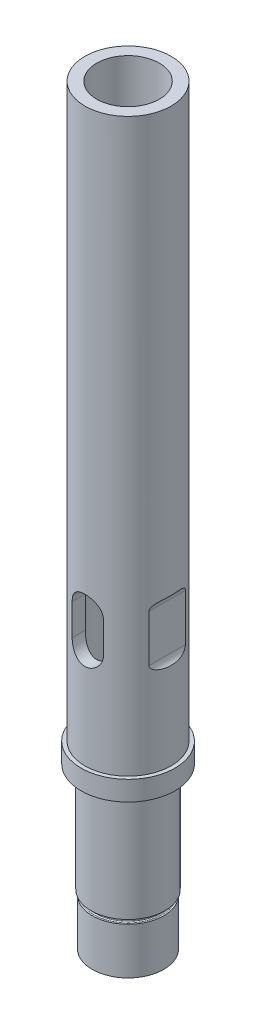
from build123d import *
from build123d.topology import SkipClean

# Parameters (mm, degrees)
SKETCH1_R               = 22.5
SKETCH1_R_2             = 9.525
BOSS_EXTRUDE1_DEPTH     = 95
SKETCH2_OUTSIDE_W       = 69.87
SKETCH2_OUTSIDE_H       = 69.87
SKETCH2_OUTSIDE_R       = 15
CUT_EXTRUDE1_DEPTH      = 50
SKETCH4_OUTSIDE_W       = 69.87
SKETCH4_OUTSIDE_H       = 69.87
SKETCH4_OUTSIDE_R       = 17.5
CUT_EXTRUDE2_DEPTH      = 37
SKETCH11_OUTSIDE_W      = 69.87
SKETCH11_OUTSIDE_H      = 69.87
SKETCH11_OUTSIDE_R      = 14.513
CUT_EXTRUDE3_DEPTH      = 5.88
SKETCH12_R              = 17.5
SKETCH12_R_2            = 9.525
BOSS_EXTRUDE2_DEPTH     = 203.2
BOSS_EXTRUDE3_START     = 15
SKETCH13_R              = 14.513
SKETCH13_R_2            = 9.525
BOSS_EXTRUDE3_DEPTH     = 15
SKETCH15_OUTSIDE_W      = 110.92
SKETCH15_OUTSIDE_H      = 110.92
SKETCH15_OUTSIDE_R      = 19.05
CUT_EXTRUDE5_DEPTH      = 251.231372933
SKETCH16_OUTSIDE_W      = 103.66
SKETCH16_OUTSIDE_H      = 103.66
SKETCH16_OUTSIDE_R      = 13.5
CUT_EXTRUDE6_DEPTH      = 2
FILLET2_R               = 0.396875
SKETCH17_R              = 17.5
CUT_EXTRUDE7_DEPTH      = 8.4
CUT_EXTRUDE8_DEPTH      = 292.049557636
CUT_EXTRUDE8_DEPTH_BACK = 292.049557636
SKETCH20_W              = 3.175
SKETCH20_H              = 25.4
FILLET3_R               = 3.175
CUT_EXTRUDE9_REACH      = 293.05
CUT_EXTRUDE9_END_RADIUS = 17.5
CUT_EXTRUDE10_REACH     = 307.988
SKETCH22_R              = 12.7


with BuildPart() as part:
    # Sketch1 → Boss-Extrude1 (new body)
    with BuildSketch(Plane(origin=(0, 0, 0), x_dir=(1, 0, 0), z_dir=(0, 1, 0))):
        with Locations(Location((0, 0, 0), (0, 0, 270))):
            Circle(SKETCH1_R)
        with Locations(Location((0, 0, 0), (0, 0, 270))):
            Circle(SKETCH1_R_2, mode=Mode.SUBTRACT)
    extrude(amount=BOSS_EXTRUDE1_DEPTH)

    # Sketch2 outside → Cut-Extrude1 (cut)
    with BuildSketch(Plane.XZ):
        Rectangle(SKETCH2_OUTSIDE_W, SKETCH2_OUTSIDE_H)
        with Locations(Location((0, 0, 0), (0, 0, 270))):
            Circle(SKETCH2_OUTSIDE_R, mode=Mode.SUBTRACT)
    extrude(amount=-CUT_EXTRUDE1_DEPTH, mode=Mode.SUBTRACT)

    # Sketch4 outside → Cut-Extrude2 (cut)
    with BuildSketch(Plane(origin=(0, 95, 0), x_dir=(1, 0, 0), z_dir=(0, 1, 0))):
        Rectangle(SKETCH4_OUTSIDE_W, SKETCH4_OUTSIDE_H)
        with Locations(Location((0, 0, 0), (0, 0, 270))):
            Circle(SKETCH4_OUTSIDE_R, mode=Mode.SUBTRACT)
    extrude(amount=-CUT_EXTRUDE2_DEPTH, mode=Mode.SUBTRACT)

    # Sketch11 outside → Cut-Extrude3 (cut)
    with BuildSketch(Plane.XZ):
        Rectangle(SKETCH11_OUTSIDE_W, SKETCH11_OUTSIDE_H)
        with Locations(Location((0, 0, 0), (0, 0, 270))):
            Circle(SKETCH11_OUTSIDE_R, mode=Mode.SUBTRACT)
    extrude(amount=-CUT_EXTRUDE3_DEPTH, mode=Mode.SUBTRACT)

    # Sketch12 → Boss-Extrude2 (add)
    with BuildSketch(Plane(origin=(0, 95, 0), x_dir=(1, 0, 0), z_dir=(0, 1, 0))):
        with Locations(Location((0, 0, 0), (0, 0, 270))):
            Circle(SKETCH12_R)
        with Locations(Location((0, 0, 0), (0, 0, 270))):
            Circle(SKETCH12_R_2, mode=Mode.SUBTRACT)
    extrude(amount=BOSS_EXTRUDE2_DEPTH)

    # Sketch13 → Boss-Extrude3 (add)
    with SkipClean():  # the faces are left unmerged after this step: merging them gives an invalid solid
        with BuildSketch(Plane.XZ.offset(BOSS_EXTRUDE3_START)):
            with Locations(Location((0, 0, 0), (0, 0, 270))):
                Circle(SKETCH13_R)
            with Locations(Location((0, 0, 0), (0, 0, 270))):
                Circle(SKETCH13_R_2, mode=Mode.SUBTRACT)
        extrude(amount=-BOSS_EXTRUDE3_DEPTH)

    # Sketch15 outside → Cut-Extrude5 (cut, through all)
    with SkipClean():  # the faces are left unmerged after this step: merging them gives an invalid solid
        with BuildSketch(Plane.XZ.offset(-50)):
            Rectangle(SKETCH15_OUTSIDE_W, SKETCH15_OUTSIDE_H)
            with Locations(Location((0, 0, 0), (0, 0, 270))):
                Circle(SKETCH15_OUTSIDE_R, mode=Mode.SUBTRACT)
        extrude(amount=-CUT_EXTRUDE5_DEPTH, mode=Mode.SUBTRACT)

    # Sketch16 outside → Cut-Extrude6 (cut)
    with SkipClean():  # the faces are left unmerged after this step: merging them gives an invalid solid
        with BuildSketch(Plane.XZ.offset(-5.88)):
            Rectangle(SKETCH16_OUTSIDE_W, SKETCH16_OUTSIDE_H)
            with Locations(Location((0, 0, 0), (0, 0, 270))):
                Circle(SKETCH16_OUTSIDE_R, mode=Mode.SUBTRACT)
        extrude(amount=CUT_EXTRUDE6_DEPTH, mode=Mode.SUBTRACT)

    # Fillet2
    fillet2_edges = [part.edges().sort_by_distance(p)[0] for p in [
        (0, 5.88, 13.5),
        (0, 3.88, 13.5),
    ]]
    fillet(fillet2_edges, radius=FILLET2_R)

    # Sketch17 → Cut-Extrude7 (cut)
    with BuildSketch(Plane(origin=(0, 298.2, 0), x_dir=(1, 0, 0), z_dir=(0, 1, 0))):
        with Locations(Location((0, 0, 0), (0, 0, 270))):
            Circle(SKETCH17_R)
    extrude(amount=-CUT_EXTRUDE7_DEPTH, mode=Mode.SUBTRACT)

    # Sketch20 → Cut-Extrude8 (cut, two sides: drawn at the far end of the back side and taken through both)
    with BuildSketch(Plane.XY.offset(-CUT_EXTRUDE8_DEPTH_BACK)):
        with Locations((-17.4625, 105.625)):
            Rectangle(SKETCH20_W, SKETCH20_H)
        with Locations((17.4625, 105.625)):
            Rectangle(SKETCH20_W, SKETCH20_H)
    extrude(amount=CUT_EXTRUDE8_DEPTH + CUT_EXTRUDE8_DEPTH_BACK, mode=Mode.SUBTRACT)

    # Fillet3
    # the kernel refuses this fillet: 3.175 mm, written as the material it adds along each edge
    with BuildSketch(Plane(origin=(-15.875, 92.925, 15.301899161), x_dir=(0, 1, 0), z_dir=(0, 0, -1))) as fillet3_piece_1_section:
        with BuildLine():
            CenterArc((FILLET3_R, -FILLET3_R), FILLET3_R, 90, 90)
            Line((0, -FILLET3_R), (0, 0))
            Line((0, 0), (FILLET3_R, 0))
        make_face()
    fillet3_piece_1 = extrude(amount=30.603798322, mode=Mode.PRIVATE)
    fillet3_piece_1 = fillet3_piece_1 & Plane(origin=(0, 93.819377515, 0), x_dir=(0, 0, 1), z_dir=(0, 1, 0)) * Cylinder(17.5, 74, mode=Mode.PRIVATE)
    add(fillet3_piece_1)
    with BuildSketch(Plane(origin=(-15.875, 118.325, 15.301899161), x_dir=(0, -1, 0), z_dir=(0, 0, -1))) as fillet3_piece_2_section:
        with BuildLine():
            CenterArc((FILLET3_R, FILLET3_R), FILLET3_R, 180, 90)
            Line((0, FILLET3_R), (0, 0))
            Line((0, 0), (FILLET3_R, 0))
        make_face()
    fillet3_piece_2 = extrude(amount=30.603798322, mode=Mode.PRIVATE)
    fillet3_piece_2 = fillet3_piece_2 & Plane(origin=(0, 117.430622485, 0), x_dir=(0, 0, 1), z_dir=(0, 1, 0)) * Cylinder(17.5, 74, mode=Mode.PRIVATE)
    add(fillet3_piece_2)
    with BuildSketch(Plane(origin=(15.875, 92.925, -15.301899161), x_dir=(0, 1, 0), z_dir=(0, 0, 1))) as fillet3_piece_3_section:
        with BuildLine():
            CenterArc((FILLET3_R, -FILLET3_R), FILLET3_R, 90, 90)
            Line((0, -FILLET3_R), (0, 0))
            Line((0, 0), (FILLET3_R, 0))
        make_face()
    fillet3_piece_3 = extrude(amount=30.603798322, mode=Mode.PRIVATE)
    fillet3_piece_3 = fillet3_piece_3 & Plane(origin=(0, 93.81935464, 0), x_dir=(0, 0, 1), z_dir=(0, 1, 0)) * Cylinder(17.5, 74, mode=Mode.PRIVATE)
    add(fillet3_piece_3)
    with BuildSketch(Plane(origin=(15.875, 118.325, -15.301899161), x_dir=(0, -1, 0), z_dir=(0, 0, 1))) as fillet3_piece_4_section:
        with BuildLine():
            CenterArc((FILLET3_R, FILLET3_R), FILLET3_R, 180, 90)
            Line((0, FILLET3_R), (0, 0))
            Line((0, 0), (FILLET3_R, 0))
        make_face()
    fillet3_piece_4 = extrude(amount=30.603798322, mode=Mode.PRIVATE)
    fillet3_piece_4 = fillet3_piece_4 & Plane(origin=(0, 117.43064536, 0), x_dir=(0, 0, 1), z_dir=(0, 1, 0)) * Cylinder(17.5, 74, mode=Mode.PRIVATE)
    add(fillet3_piece_4)

    # Cut-Extrude9: up to this cylinder (the profile starts inside it)
    cut_extrude9_end = Plane(origin=(0, 105.625, 0), z_dir=(0, 1, 0)) * Cylinder(CUT_EXTRUDE9_END_RADIUS, 622.1, mode=Mode.PRIVATE)
    # Sketch21 → Cut-Extrude9 (cut, up to the surface)
    with BuildSketch(Plane.XY, mode=Mode.PRIVATE) as cut_extrude9_sk1:
        with BuildLine():
            Line((-6.35, 99.275), (-6.35, 111.975))
            ThreePointArc((-6.35, 111.975), (0, 118.325), (6.35, 111.975))
            Line((6.35, 111.975), (6.35, 99.275))
            ThreePointArc((6.35, 99.275), (0, 92.925), (-6.35, 99.275))
        make_face()
    cut_extrude9_tool1 = extrude(cut_extrude9_sk1.sketch, amount=CUT_EXTRUDE9_REACH, mode=Mode.PRIVATE) & cut_extrude9_end
    add(cut_extrude9_tool1.solids().sort_by_distance((0, 105.625, 0))[0], mode=Mode.SUBTRACT)

    # Cut-Extrude10: up to this face of the body (flat: up to its plane)
    cut_extrude10_end = Plane(part.part.faces().sort_by_distance((0, -15, 14.102510371))[0])
    # Sketch22 → Cut-Extrude10 (cut, up to the picked face)
    with BuildSketch(Plane(origin=(0, 289.8, 0), x_dir=(1, 0, 0), z_dir=(0, 1, 0)), mode=Mode.PRIVATE) as cut_extrude10_sk1:
        with Locations(Location((0, 0, 0), (0, 0, 270))):
            Circle(SKETCH22_R)
    cut_extrude10_tool1 = split(extrude(cut_extrude10_sk1.sketch, amount=-CUT_EXTRUDE10_REACH, mode=Mode.PRIVATE), bisect_by=cut_extrude10_end, keep=Keep.BOTH, mode=Mode.PRIVATE)
    add(cut_extrude10_tool1.solids().sort_by(Axis((0, 289.8, 0), (0, -1, 0)))[0], mode=Mode.SUBTRACT)


solid = part.part
